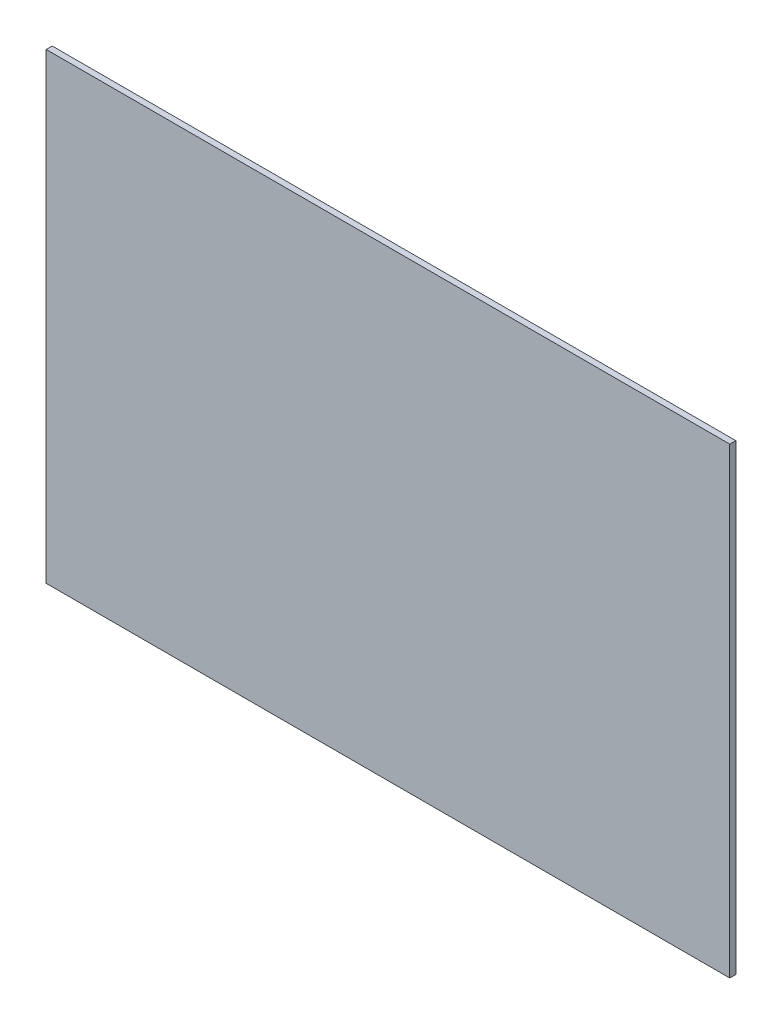
from build123d import *

# Parameters (mm, degrees)
SKETCH1_W           = 340
SKETCH1_H           = 230
BOSS_EXTRUDE1_DEPTH = 3


with BuildPart() as part:
    # Sketch1 → Boss-Extrude1 (new body)
    with BuildSketch(Plane.XY):
        Rectangle(SKETCH1_W, SKETCH1_H)
    extrude(amount=BOSS_EXTRUDE1_DEPTH)


solid = part.part
